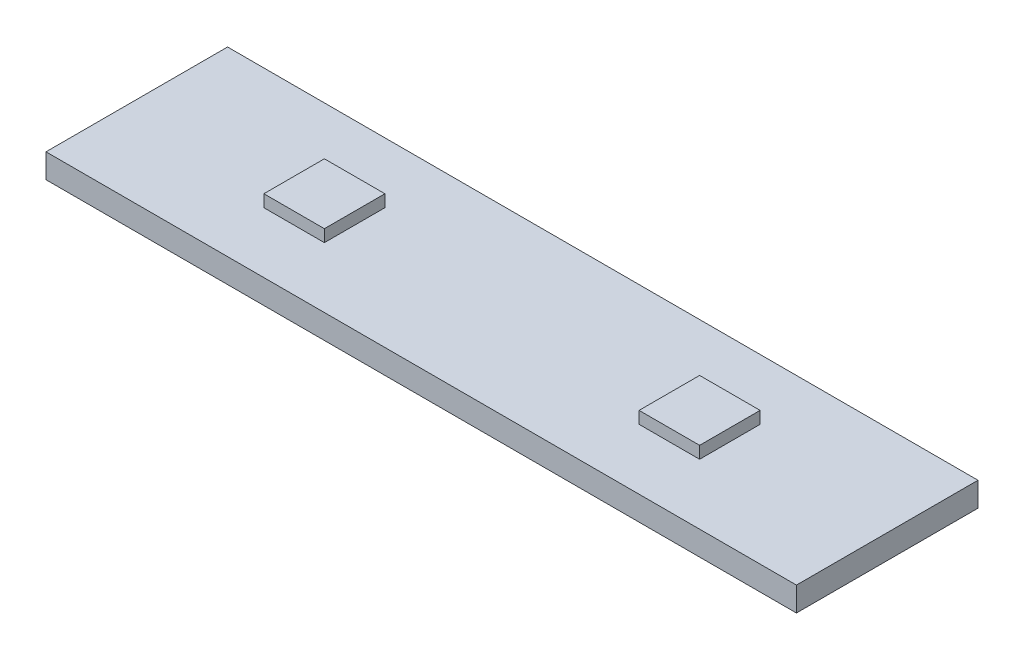
from build123d import *

# Parameters (mm, degrees)
SKETCH1_W           = 62
SKETCH1_H           = 15
BOSS_EXTRUDE1_DEPTH = 2
SKETCH2_W           = 5
SKETCH2_H           = 5
BOSS_EXTRUDE2_DEPTH = 1


with BuildPart() as part:
    # Sketch1 → Boss-Extrude1 (new body)
    with BuildSketch(Plane(origin=(0, 0, 0), x_dir=(1, 0, 0), z_dir=(0, 1, 0))):
        with Locations((31, 7.5)):
            Rectangle(SKETCH1_W, SKETCH1_H)
    extrude(amount=BOSS_EXTRUDE1_DEPTH)

    # Sketch2 → Boss-Extrude2 (add)
    with BuildSketch(Plane(origin=(0, 2, 0), x_dir=(1, 0, 0), z_dir=(0, 1, 0))):
        with Locations((15.5, 7.5)):
            Rectangle(SKETCH2_W, SKETCH2_H)
        with Locations((46.5, 7.5)):
            Rectangle(SKETCH2_W, SKETCH2_H)
    extrude(amount=BOSS_EXTRUDE2_DEPTH)


solid = part.part
